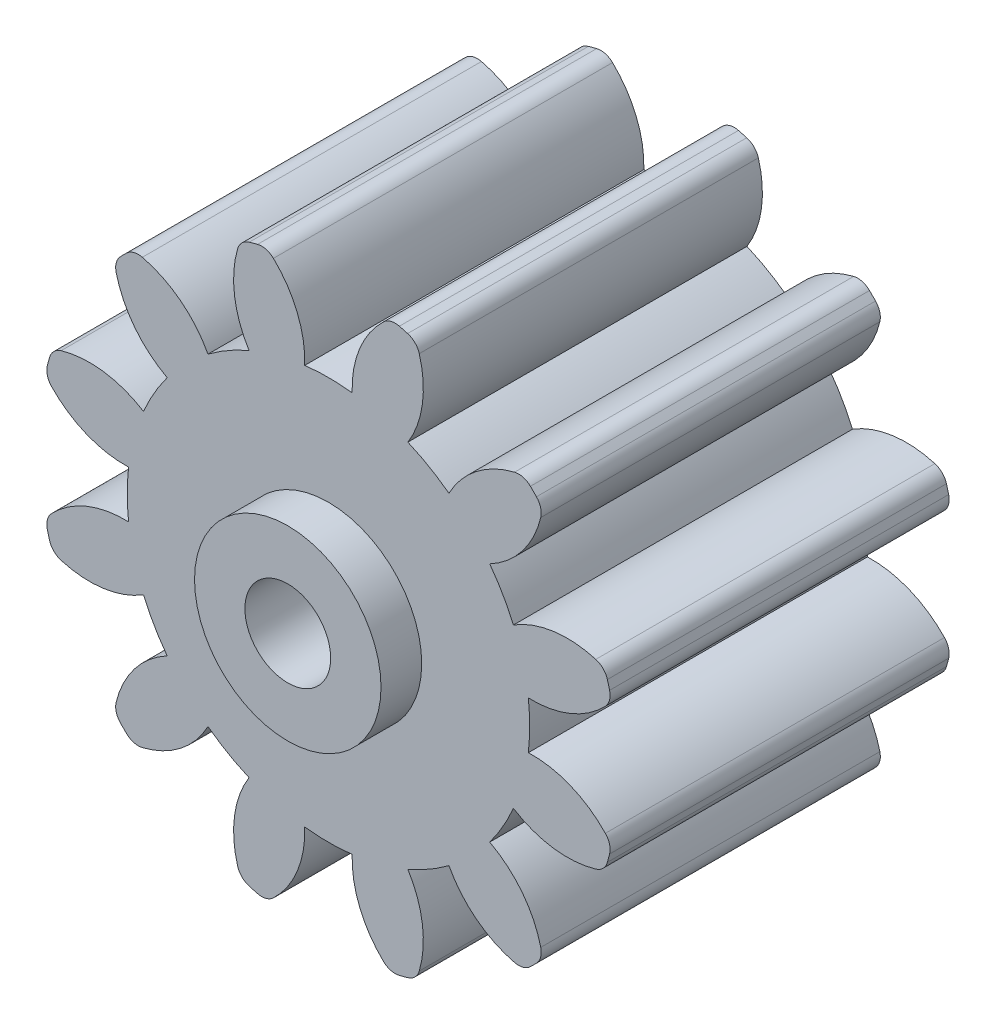
from build123d import *

# Parameters (mm, degrees)
SKETCH_1_R               = 1.265
EXTRUDE_1_DEPTH          = 10
SKETCH_2_R               = 2.75
SKETCH_2_R_2             = 1.265
EXTRUDE_2_DEPTH          = 1.2
SKETCH_3_R               = 10.210079725
SKETCH_3_R_2             = 7.3
CUT_EXTRUDE_2_DEPTH      = 16.316956182
FILLET_1_R               = 0.5
PATTERN_CIRCULAR_2_DEPTH = 10
CUT_EXTRUDE_START        = -10
SKETCH_5_R               = 9.117609572
SKETCH_5_R_2             = 4.6865
CUT_EXTRUDE_3_DEPTH      = 10
EXTRUDE_START            = -10
SKETCH_4_R               = 1.265
EXTRUDE_3_DEPTH          = 10
SKETCH_6_R               = 15.550265039
SKETCH_6_R_2             = 8.55
CUT_EXTRUDE_4_DEPTH      = 10
FILLET_2_R               = 0.5
PATTERN_CIRCULAR_4_DEPTH = 10


# Read off the part's stored shape, not the designer's step: Круговой массив2, Круговой массив4
with BuildPart() as part:
    # Эскиз1 → Бобышка-Вытянуть1 (new body)
    with BuildSketch(Plane.XY):
        with BuildLine():
            ThreePointArc((-3.148803906, 3.471068454), (-4.227852242, 4.566214035), (-5.743712894, 4.822837566))
            ThreePointArc((-5.743712894, 4.822837566), (-5.841480421, 4.703945843), (-5.936787387, 4.583072716))
            ThreePointArc((-5.936787387, 4.583072716), (-5.362797198, 3.156810321), (-4.062728379, 2.336133637))
            ThreePointArc((-4.062728379, 2.336133637), (-4.379801209, 1.667520202), (-4.587678719, 0.95733287))
            ThreePointArc((-4.587678719, 0.95733287), (-6.104357582, 1.209075557), (-7.481554138, 0.525687819))
            ThreePointArc((-7.481554138, 0.525687819), (-7.490766927, 0.372036085), (-7.496824441, 0.218227641))
            ThreePointArc((-7.496824441, 0.218227641), (-6.194120622, -0.598259906), (-4.659961201, -0.498040012))
            ThreePointArc((-4.659961201, -0.498040012), (-4.523477392, -1.225330377), (-4.274216191, -1.922071332))
            ThreePointArc((-4.274216191, -1.922071332), (-5.649205805, -2.609888688), (-6.361695989, -3.972256807))
            ThreePointArc((-6.361695989, -3.972256807), (-6.278835069, -4.101978813), (-6.193329365, -4.229972975))
            ThreePointArc((-6.193329365, -4.229972975), (-4.659500498, -4.124815183), (-3.477247231, -3.141979304))
            ThreePointArc((-3.477247231, -3.141979304), (-2.939338959, -3.650146399), (-2.328148353, -4.067309614))
            ThreePointArc((-2.328148353, -4.067309614), (-3.03624942, -5.431964161), (-2.811886199, -6.952934345))
            ThreePointArc((-2.811886199, -6.952934345), (-2.668601624, -7.009177225), (-2.524192976, -7.062467686))
            ThreePointArc((-2.524192976, -7.062467686), (-1.345109555, -6.075831258), (-0.966343005, -4.585789294))
            ThreePointArc((-0.966343005, -4.585789294), (-0.232472948, -4.68073056), (0.507193024, -4.658973866))
            ThreePointArc((0.507193024, -4.658973866), (0.736451045, -6.179213951), (1.811968547, -7.277827285))
            ThreePointArc((1.811968547, -7.277827285), (1.960946938, -7.239108171), (2.109099336, -7.197339786))
            ThreePointArc((2.109099336, -7.197339786), (2.483067519, -5.706086302), (1.913671403, -4.277983638))
            ThreePointArc((1.913671403, -4.277983638), (2.563189827, -3.92343474), (3.148803906, -3.471068454))
            ThreePointArc((3.148803906, -3.471068454), (4.227852242, -4.566214035), (5.743712894, -4.822837566))
            ThreePointArc((5.743712894, -4.822837566), (5.841480421, -4.703945843), (5.936787387, -4.583072716))
            ThreePointArc((5.936787387, -4.583072716), (5.362797198, -3.156810321), (4.062728379, -2.336133637))
            ThreePointArc((4.062728379, -2.336133637), (4.379801209, -1.667520202), (4.587678719, -0.95733287))
            ThreePointArc((4.587678719, -0.95733287), (6.104357582, -1.209075557), (7.481554138, -0.525687819))
            ThreePointArc((7.481554138, -0.525687819), (7.490766927, -0.372036085), (7.496824441, -0.218227641))
            ThreePointArc((7.496824441, -0.218227641), (6.194120622, 0.598259906), (4.659961201, 0.498040012))
            ThreePointArc((4.659961201, 0.498040012), (4.523477392, 1.225330377), (4.274216191, 1.922071332))
            ThreePointArc((4.274216191, 1.922071332), (5.649205805, 2.609888688), (6.361695989, 3.972256807))
            ThreePointArc((6.361695989, 3.972256807), (6.278835069, 4.101978813), (6.193329365, 4.229972975))
            ThreePointArc((6.193329365, 4.229972975), (4.659500498, 4.124815183), (3.477247231, 3.141979304))
            ThreePointArc((3.477247231, 3.141979304), (2.939338959, 3.650146399), (2.328148353, 4.067309614))
            ThreePointArc((2.328148353, 4.067309614), (3.03624942, 5.431964161), (2.811886199, 6.952934345))
            ThreePointArc((2.811886199, 6.952934345), (2.668601624, 7.009177225), (2.524192976, 7.062467686))
            ThreePointArc((2.524192976, 7.062467686), (1.345109555, 6.075831258), (0.966343005, 4.585789294))
            ThreePointArc((0.966343005, 4.585789294), (0.232472948, 4.68073056), (-0.507193024, 4.658973866))
            ThreePointArc((-0.507193024, 4.658973866), (-0.736451045, 6.179213951), (-1.811968547, 7.277827285))
            ThreePointArc((-1.811968547, 7.277827285), (-1.960946938, 7.239108171), (-2.109099336, 7.197339786))
            ThreePointArc((-2.109099336, 7.197339786), (-2.483067519, 5.706086302), (-1.913671403, 4.277983638))
            ThreePointArc((-1.913671403, 4.277983638), (-2.563189827, 3.92343474), (-3.148803906, 3.471068454))
        make_face()
        Circle(SKETCH_1_R, mode=Mode.SUBTRACT)
    extrude(amount=EXTRUDE_1_DEPTH)

    # Эскиз2 → Бобышка-Вытянуть2 (add)
    with BuildSketch(Plane.XY.offset(10)):
        Circle(SKETCH_2_R)
        Circle(SKETCH_2_R_2, mode=Mode.SUBTRACT)
    extrude(amount=EXTRUDE_2_DEPTH)

    # Эскиз3 → Вырез-Вытянуть2 (cut, through all)
    with BuildSketch(Plane(origin=(0, 0, 0), x_dir=(-1, 0, 0), z_dir=(0, 0, -1))):
        Circle(SKETCH_3_R)
        Circle(SKETCH_3_R_2, mode=Mode.SUBTRACT)
    extrude(amount=-CUT_EXTRUDE_2_DEPTH, mode=Mode.SUBTRACT)

    # Скругление1
    fillet_1_edges = [part.edges().sort_by_distance(p)[0] for p in [
        (-2.246892365, 6.945608303, 5),
        (-1.565958675, 7.13006125, 5),
    ]]
    fillet(fillet_1_edges, radius=FILLET_1_R)

    # Круговой массив2 outline → Круговой массив2 (cut)
    with BuildSketch(Plane.XY):
        with BuildLine():
            ThreePointArc((-5.838293306, 4.042408612), (-5.850561559, 4.278183981), (-5.753278974, 4.493304024))
            ThreePointArc((-5.753278974, 4.493304024), (-5.827604273, 4.396479095), (-5.900300237, 4.298424958))
            ThreePointArc((-5.900300237, 4.298424958), (-5.872671085, 4.169599529), (-5.838293306, 4.042408612))
        make_face()
        with BuildLine():
            ThreePointArc((-5.457832031, 4.847893307), (-5.538127486, 4.755958783), (-5.61687454, 4.662694543))
            ThreePointArc((-5.61687454, 4.662694543), (-5.427449488, 4.803615386), (-5.19448163, 4.841910441))
            ThreePointArc((-5.19448163, 4.841910441), (-5.326077976, 4.84837285), (-5.457832031, 4.847893307))
        make_face()
        with BuildLine():
            ThreePointArc((-7.099346669, -0.161285439), (-7.247857179, 0.022249743), (-7.295598302, 0.253466783))
            ThreePointArc((-7.295598302, 0.253466783), (-7.298816468, 0.131446456), (-7.299993962, 0.009389377))
            ThreePointArc((-7.299993962, 0.009389377), (-7.201919821, -0.078592576), (-7.099346669, -0.161285439))
        make_face()
        with BuildLine():
            ThreePointArc((-7.264999056, 0.713994895), (-7.275921686, 0.592421818), (-7.284810046, 0.470683106))
            ThreePointArc((-7.284810046, 0.470683106), (-7.214393154, 0.696031715), (-7.048427465, 0.863948137))
            ThreePointArc((-7.048427465, 0.863948137), (-7.158689654, 0.791825944), (-7.264999056, 0.713994895))
        make_face()
        with BuildLine():
            ThreePointArc((-5.648690902, -4.303373934), (-5.876717701, -4.24218314), (-6.051247048, -4.083186154))
            ThreePointArc((-6.051247048, -4.083186154), (-5.982128849, -4.183794263), (-5.911338111, -4.283232627))
            ThreePointArc((-5.911338111, -4.283232627), (-5.78027997, -4.296764989), (-5.648690902, -4.303373934))
        make_face()
        with BuildLine():
            ThreePointArc((-6.29718337, -3.692625299), (-6.234561102, -3.797400146), (-6.170195716, -3.90111328))
            ThreePointArc((-6.170195716, -3.90111328), (-6.245683843, -3.677412414), (-6.210113576, -3.444012991))
            ThreePointArc((-6.210113576, -3.444012991), (-6.2569252, -3.567171559), (-6.29718337, -3.692625299))
        make_face()
        with BuildLine():
            ThreePointArc((-2.040427202, -6.801719852), (-2.260871804, -6.88624625), (-2.495525095, -6.860200762))
            ThreePointArc((-2.495525095, -6.860200762), (-2.380471335, -6.900967774), (-2.264752021, -6.939805349))
            ThreePointArc((-2.264752021, -6.939805349), (-2.150769635, -6.873719217), (-2.040427202, -6.801719852))
        make_face()
        with BuildLine():
            ThreePointArc((-2.92405767, -6.688788137), (-2.811810081, -6.736744322), (-2.69877634, -6.782816986))
            ThreePointArc((-2.69877634, -6.782816986), (-2.891335587, -6.646209992), (-2.999747375, -6.436478214))
            ThreePointArc((-2.999747375, -6.436478214), (-2.965227985, -6.563630771), (-2.92405767, -6.688788137))
        make_face()
        with BuildLine():
            ThreePointArc((2.347210337, -6.702039969), (2.218550278, -6.899997348), (2.013402624, -7.016851849))
            ThreePointArc((2.013402624, -7.016851849), (2.130445319, -6.982206151), (2.246892365, -6.945608303))
            ThreePointArc((2.246892365, -6.945608303), (2.300261598, -6.825146334), (2.347210337, -6.702039969))
        make_face()
        with BuildLine():
            ThreePointArc((1.565958675, -7.13006125), (1.684956821, -7.102881142), (1.80348387, -7.073715143))
            ThreePointArc((1.80348387, -7.073715143), (1.56740459, -7.076381249), (1.356420365, -6.970427527))
            ThreePointArc((1.356420365, -6.970427527), (1.459085537, -7.053006118), (1.565958675, -7.13006125))
        make_face()
        with BuildLine():
            ThreePointArc((5.838293306, -4.042408612), (5.850561559, -4.278183981), (5.753278974, -4.493304024))
            ThreePointArc((5.753278974, -4.493304024), (5.827604273, -4.396479095), (5.900300237, -4.298424958))
            ThreePointArc((5.900300237, -4.298424958), (5.872671085, -4.169599529), (5.838293306, -4.042408612))
        make_face()
        with BuildLine():
            ThreePointArc((5.457832031, -4.847893307), (5.538127486, -4.755958783), (5.61687454, -4.662694543))
            ThreePointArc((5.61687454, -4.662694543), (5.427449488, -4.803615386), (5.19448163, -4.841910441))
            ThreePointArc((5.19448163, -4.841910441), (5.326077976, -4.84837285), (5.457832031, -4.847893307))
        make_face()
        with BuildLine():
            ThreePointArc((7.099346669, 0.161285439), (7.247857179, -0.022249743), (7.295598302, -0.253466783))
            ThreePointArc((7.295598302, -0.253466783), (7.298816468, -0.131446456), (7.299993962, -0.009389377))
            ThreePointArc((7.299993962, -0.009389377), (7.201919821, 0.078592576), (7.099346669, 0.161285439))
        make_face()
        with BuildLine():
            ThreePointArc((7.264999056, -0.713994895), (7.275921686, -0.592421818), (7.284810046, -0.470683106))
            ThreePointArc((7.284810046, -0.470683106), (7.214393154, -0.696031715), (7.048427465, -0.863948137))
            ThreePointArc((7.048427465, -0.863948137), (7.158689654, -0.791825944), (7.264999056, -0.713994895))
        make_face()
        with BuildLine():
            ThreePointArc((5.648690902, 4.303373934), (5.876717701, 4.24218314), (6.051247048, 4.083186154))
            ThreePointArc((6.051247048, 4.083186154), (5.982128849, 4.183794263), (5.911338111, 4.283232627))
            ThreePointArc((5.911338111, 4.283232627), (5.78027997, 4.296764989), (5.648690902, 4.303373934))
        make_face()
        with BuildLine():
            ThreePointArc((6.29718337, 3.692625299), (6.234561102, 3.797400146), (6.170195716, 3.90111328))
            ThreePointArc((6.170195716, 3.90111328), (6.245683843, 3.677412414), (6.210113576, 3.444012991))
            ThreePointArc((6.210113576, 3.444012991), (6.2569252, 3.567171559), (6.29718337, 3.692625299))
        make_face()
        with BuildLine():
            ThreePointArc((2.040427202, 6.801719852), (2.260871804, 6.88624625), (2.495525095, 6.860200762))
            ThreePointArc((2.495525095, 6.860200762), (2.380471335, 6.900967774), (2.264752021, 6.939805349))
            ThreePointArc((2.264752021, 6.939805349), (2.150769635, 6.873719217), (2.040427202, 6.801719852))
        make_face()
        with BuildLine():
            ThreePointArc((2.92405767, 6.688788137), (2.811810081, 6.736744322), (2.69877634, 6.782816986))
            ThreePointArc((2.69877634, 6.782816986), (2.891335587, 6.646209992), (2.999747375, 6.436478214))
            ThreePointArc((2.999747375, 6.436478214), (2.965227985, 6.563630771), (2.92405767, 6.688788137))
        make_face()
    extrude(amount=PATTERN_CIRCULAR_2_DEPTH, mode=Mode.SUBTRACT)

    # Эскиз5 → Вырез-Вытянуть3 (cut)
    with BuildSketch(Plane.XY.offset(10).offset(CUT_EXTRUDE_START)):
        Circle(SKETCH_5_R)
        Circle(SKETCH_5_R_2, mode=Mode.SUBTRACT)
    extrude(amount=CUT_EXTRUDE_3_DEPTH, mode=Mode.SUBTRACT)

    # Эскиз4 → Бобышка-Вытянуть3 (add)
    with BuildSketch(Plane.XY.offset(10).offset(EXTRUDE_START)):
        with BuildLine():
            ThreePointArc((4.755723654, 3.55318516), (5.872933327, 4.582980438), (6.342289434, 6.028089642))
            ThreePointArc((6.342289434, 6.028089642), (6.187184335, 6.187184335), (6.028089642, 6.342289434))
            ThreePointArc((6.028089642, 6.342289434), (4.582980438, 5.872933327), (3.55318516, 4.755723654))
            ThreePointArc((3.55318516, 4.755723654), (2.96825, 5.14115981), (2.341984918, 5.45501044))
            ThreePointArc((2.341984918, 5.45501044), (2.794619237, 6.905444148), (2.478538947, 8.391623483))
            ThreePointArc((2.478538947, 8.391623483), (2.264666645, 8.45185098), (2.049334049, 8.506628589))
            ThreePointArc((2.049334049, 8.506628589), (1.03251082, 7.377599675), (0.699286786, 5.895170077))
            ThreePointArc((0.699286786, 5.895170077), (0, 5.9365), (-0.699286786, 5.895170077))
            ThreePointArc((-0.699286786, 5.895170077), (-1.03251082, 7.377599675), (-2.049334049, 8.506628589))
            ThreePointArc((-2.049334049, 8.506628589), (-2.264666645, 8.45185098), (-2.478538947, 8.391623483))
            ThreePointArc((-2.478538947, 8.391623483), (-2.794619237, 6.905444148), (-2.341984918, 5.45501044))
            ThreePointArc((-2.341984918, 5.45501044), (-2.96825, 5.14115981), (-3.55318516, 4.755723654))
            ThreePointArc((-3.55318516, 4.755723654), (-4.582980438, 5.872933327), (-6.028089642, 6.342289434))
            ThreePointArc((-6.028089642, 6.342289434), (-6.187184335, 6.187184335), (-6.342289434, 6.028089642))
            ThreePointArc((-6.342289434, 6.028089642), (-5.872933327, 4.582980438), (-4.755723654, 3.55318516))
            ThreePointArc((-4.755723654, 3.55318516), (-5.14115981, 2.96825), (-5.45501044, 2.341984918))
            ThreePointArc((-5.45501044, 2.341984918), (-6.905444148, 2.794619237), (-8.391623483, 2.478538947))
            ThreePointArc((-8.391623483, 2.478538947), (-8.45185098, 2.264666645), (-8.506628589, 2.049334049))
            ThreePointArc((-8.506628589, 2.049334049), (-7.377599675, 1.03251082), (-5.895170077, 0.699286786))
            ThreePointArc((-5.895170077, 0.699286786), (-5.9365, 0), (-5.895170077, -0.699286786))
            ThreePointArc((-5.895170077, -0.699286786), (-7.377599675, -1.03251082), (-8.506628589, -2.049334049))
            ThreePointArc((-8.506628589, -2.049334049), (-8.45185098, -2.264666645), (-8.391623483, -2.478538947))
            ThreePointArc((-8.391623483, -2.478538947), (-6.905444148, -2.794619237), (-5.45501044, -2.341984918))
            ThreePointArc((-5.45501044, -2.341984918), (-5.14115981, -2.96825), (-4.755723654, -3.55318516))
            ThreePointArc((-4.755723654, -3.55318516), (-5.872933327, -4.582980438), (-6.342289434, -6.028089642))
            ThreePointArc((-6.342289434, -6.028089642), (-6.187184335, -6.187184335), (-6.028089642, -6.342289434))
            ThreePointArc((-6.028089642, -6.342289434), (-4.582980438, -5.872933327), (-3.55318516, -4.755723654))
            ThreePointArc((-3.55318516, -4.755723654), (-2.96825, -5.14115981), (-2.341984918, -5.45501044))
            ThreePointArc((-2.341984918, -5.45501044), (-2.794619237, -6.905444148), (-2.478538947, -8.391623483))
            ThreePointArc((-2.478538947, -8.391623483), (-2.264666645, -8.45185098), (-2.049334049, -8.506628589))
            ThreePointArc((-2.049334049, -8.506628589), (-1.03251082, -7.377599675), (-0.699286786, -5.895170077))
            ThreePointArc((-0.699286786, -5.895170077), (0, -5.9365), (0.699286786, -5.895170077))
            ThreePointArc((0.699286786, -5.895170077), (1.03251082, -7.377599675), (2.049334049, -8.506628589))
            ThreePointArc((2.049334049, -8.506628589), (2.264666645, -8.45185098), (2.478538947, -8.391623483))
            ThreePointArc((2.478538947, -8.391623483), (2.794619237, -6.905444148), (2.341984918, -5.45501044))
            ThreePointArc((2.341984918, -5.45501044), (2.96825, -5.14115981), (3.55318516, -4.755723654))
            ThreePointArc((3.55318516, -4.755723654), (4.582980438, -5.872933327), (6.028089642, -6.342289434))
            ThreePointArc((6.028089642, -6.342289434), (6.187184335, -6.187184335), (6.342289434, -6.028089642))
            ThreePointArc((6.342289434, -6.028089642), (5.872933327, -4.582980438), (4.755723654, -3.55318516))
            ThreePointArc((4.755723654, -3.55318516), (5.14115981, -2.96825), (5.45501044, -2.341984918))
            ThreePointArc((5.45501044, -2.341984918), (6.905444148, -2.794619237), (8.391623483, -2.478538947))
            ThreePointArc((8.391623483, -2.478538947), (8.45185098, -2.264666645), (8.506628589, -2.049334049))
            ThreePointArc((8.506628589, -2.049334049), (7.377599675, -1.03251082), (5.895170077, -0.699286786))
            ThreePointArc((5.895170077, -0.699286786), (5.9365, 0), (5.895170077, 0.699286786))
            ThreePointArc((5.895170077, 0.699286786), (7.377599675, 1.03251082), (8.506628589, 2.049334049))
            ThreePointArc((8.506628589, 2.049334049), (8.45185098, 2.264666645), (8.391623483, 2.478538947))
            ThreePointArc((8.391623483, 2.478538947), (6.905444148, 2.794619237), (5.45501044, 2.341984918))
            ThreePointArc((5.45501044, 2.341984918), (5.14115981, 2.96825), (4.755723654, 3.55318516))
        make_face()
        Circle(SKETCH_4_R, mode=Mode.SUBTRACT)
    extrude(amount=EXTRUDE_3_DEPTH)

    # Эскиз6 → Вырез-Вытянуть4 (cut)
    with BuildSketch(Plane.XY.offset(10)):
        Circle(SKETCH_6_R)
        Circle(SKETCH_6_R_2, mode=Mode.SUBTRACT)
    extrude(amount=-CUT_EXTRUDE_4_DEPTH, mode=Mode.SUBTRACT)

    # Скругление2
    fillet_2_edges = [part.edges().sort_by_distance(p)[0] for p in [
        (-1.834015536, 8.350981201, 5),
        (-2.587186555, 8.149169634, 5),
    ]]
    fillet(fillet_2_edges, radius=FILLET_2_R)

    # Круговой массив4 outline → Круговой массив4 (cut)
    with BuildSketch(Plane.XY):
        with BuildLine():
            ThreePointArc((5.763794646, 6.315154098), (5.625595497, 6.291434191), (5.48865567, 6.261282532))
            ThreePointArc((5.48865567, 6.261282532), (5.738638085, 6.258135911), (5.955848779, 6.134359406))
            ThreePointArc((5.955848779, 6.134359406), (5.860518934, 6.225497395), (5.763794646, 6.315154098))
        make_face()
        with BuildLine():
            ThreePointArc((6.315154098, 5.763794646), (6.225497395, 5.860518934), (6.134359406, 5.955848779))
            ThreePointArc((6.134359406, 5.955848779), (6.258135911, 5.738638085), (6.261282532, 5.48865567))
            ThreePointArc((6.261282532, 5.48865567), (6.291434191, 5.625595497), (6.315154098, 5.763794646))
        make_face()
        with BuildLine():
            ThreePointArc((1.834015536, 8.350981201), (1.726191515, 8.261339585), (1.622673976, 8.166757568))
            ThreePointArc((1.622673976, 8.166757568), (1.840738409, 8.289023721), (2.090736641, 8.290435471))
            ThreePointArc((2.090736641, 8.290435471), (1.962609579, 8.321698363), (1.834015536, 8.350981201))
        make_face()
        with BuildLine():
            ThreePointArc((2.587186555, 8.149169634), (2.461179428, 8.188106974), (2.334586692, 8.225096047))
            ThreePointArc((2.334586692, 8.225096047), (2.550385637, 8.09887432), (2.678101898, 7.883956508))
            ThreePointArc((2.678101898, 7.883956508), (2.635744088, 8.017625707), (2.587186555, 8.149169634))
        make_face()
        with BuildLine():
            ThreePointArc((-6.315154098, 5.763794646), (-6.291434191, 5.625595497), (-6.261282532, 5.48865567))
            ThreePointArc((-6.261282532, 5.48865567), (-6.258135911, 5.738638085), (-6.134359406, 5.955848779))
            ThreePointArc((-6.134359406, 5.955848779), (-6.225497395, 5.860518934), (-6.315154098, 5.763794646))
        make_face()
        with BuildLine():
            ThreePointArc((-5.763794646, 6.315154098), (-5.860518934, 6.225497395), (-5.955848779, 6.134359406))
            ThreePointArc((-5.955848779, 6.134359406), (-5.738638085, 6.258135911), (-5.48865567, 6.261282532))
            ThreePointArc((-5.48865567, 6.261282532), (-5.625595497, 6.291434191), (-5.763794646, 6.315154098))
        make_face()
        with BuildLine():
            ThreePointArc((-8.350981201, 1.834015536), (-8.261339585, 1.726191515), (-8.166757568, 1.622673976))
            ThreePointArc((-8.166757568, 1.622673976), (-8.289023721, 1.840738409), (-8.290435471, 2.090736641))
            ThreePointArc((-8.290435471, 2.090736641), (-8.321698363, 1.962609579), (-8.350981201, 1.834015536))
        make_face()
        with BuildLine():
            ThreePointArc((-8.149169634, 2.587186555), (-8.188106974, 2.461179428), (-8.225096047, 2.334586692))
            ThreePointArc((-8.225096047, 2.334586692), (-8.09887432, 2.550385637), (-7.883956508, 2.678101898))
            ThreePointArc((-7.883956508, 2.678101898), (-8.017625707, 2.635744088), (-8.149169634, 2.587186555))
        make_face()
        with BuildLine():
            ThreePointArc((-8.149169634, -2.587186555), (-8.017625707, -2.635744088), (-7.883956508, -2.678101898))
            ThreePointArc((-7.883956508, -2.678101898), (-8.09887432, -2.550385637), (-8.225096047, -2.334586692))
            ThreePointArc((-8.225096047, -2.334586692), (-8.188106974, -2.461179428), (-8.149169634, -2.587186555))
        make_face()
        with BuildLine():
            ThreePointArc((-8.350981201, -1.834015536), (-8.321698363, -1.962609579), (-8.290435471, -2.090736641))
            ThreePointArc((-8.290435471, -2.090736641), (-8.289023721, -1.840738409), (-8.166757568, -1.622673976))
            ThreePointArc((-8.166757568, -1.622673976), (-8.261339585, -1.726191515), (-8.350981201, -1.834015536))
        make_face()
        with BuildLine():
            ThreePointArc((-5.763794646, -6.315154098), (-5.625595497, -6.291434191), (-5.48865567, -6.261282532))
            ThreePointArc((-5.48865567, -6.261282532), (-5.738638085, -6.258135911), (-5.955848779, -6.134359406))
            ThreePointArc((-5.955848779, -6.134359406), (-5.860518934, -6.225497395), (-5.763794646, -6.315154098))
        make_face()
        with BuildLine():
            ThreePointArc((-6.315154098, -5.763794646), (-6.225497395, -5.860518934), (-6.134359406, -5.955848779))
            ThreePointArc((-6.134359406, -5.955848779), (-6.258135911, -5.738638085), (-6.261282532, -5.48865567))
            ThreePointArc((-6.261282532, -5.48865567), (-6.291434191, -5.625595497), (-6.315154098, -5.763794646))
        make_face()
        with BuildLine():
            ThreePointArc((-1.834015536, -8.350981201), (-1.726191515, -8.261339585), (-1.622673976, -8.166757568))
            ThreePointArc((-1.622673976, -8.166757568), (-1.840738409, -8.289023721), (-2.090736641, -8.290435471))
            ThreePointArc((-2.090736641, -8.290435471), (-1.962609579, -8.321698363), (-1.834015536, -8.350981201))
        make_face()
        with BuildLine():
            ThreePointArc((-2.587186555, -8.149169634), (-2.461179428, -8.188106974), (-2.334586692, -8.225096047))
            ThreePointArc((-2.334586692, -8.225096047), (-2.550385637, -8.09887432), (-2.678101898, -7.883956508))
            ThreePointArc((-2.678101898, -7.883956508), (-2.635744088, -8.017625707), (-2.587186555, -8.149169634))
        make_face()
        with BuildLine():
            ThreePointArc((2.587186555, -8.149169634), (2.635744088, -8.017625707), (2.678101898, -7.883956508))
            ThreePointArc((2.678101898, -7.883956508), (2.550385637, -8.09887432), (2.334586692, -8.225096047))
            ThreePointArc((2.334586692, -8.225096047), (2.461179428, -8.188106974), (2.587186555, -8.149169634))
        make_face()
        with BuildLine():
            ThreePointArc((1.834015536, -8.350981201), (1.962609579, -8.321698363), (2.090736641, -8.290435471))
            ThreePointArc((2.090736641, -8.290435471), (1.840738409, -8.289023721), (1.622673976, -8.166757568))
            ThreePointArc((1.622673976, -8.166757568), (1.726191515, -8.261339585), (1.834015536, -8.350981201))
        make_face()
        with BuildLine():
            ThreePointArc((6.315154098, -5.763794646), (6.291434191, -5.625595497), (6.261282532, -5.48865567))
            ThreePointArc((6.261282532, -5.48865567), (6.258135911, -5.738638085), (6.134359406, -5.955848779))
            ThreePointArc((6.134359406, -5.955848779), (6.225497395, -5.860518934), (6.315154098, -5.763794646))
        make_face()
        with BuildLine():
            ThreePointArc((5.763794646, -6.315154098), (5.860518934, -6.225497395), (5.955848779, -6.134359406))
            ThreePointArc((5.955848779, -6.134359406), (5.738638085, -6.258135911), (5.48865567, -6.261282532))
            ThreePointArc((5.48865567, -6.261282532), (5.625595497, -6.291434191), (5.763794646, -6.315154098))
        make_face()
        with BuildLine():
            ThreePointArc((8.350981201, -1.834015536), (8.261339585, -1.726191515), (8.166757568, -1.622673976))
            ThreePointArc((8.166757568, -1.622673976), (8.289023721, -1.840738409), (8.290435471, -2.090736641))
            ThreePointArc((8.290435471, -2.090736641), (8.321698363, -1.962609579), (8.350981201, -1.834015536))
        make_face()
        with BuildLine():
            ThreePointArc((8.149169634, -2.587186555), (8.188106974, -2.461179428), (8.225096047, -2.334586692))
            ThreePointArc((8.225096047, -2.334586692), (8.09887432, -2.550385637), (7.883956508, -2.678101898))
            ThreePointArc((7.883956508, -2.678101898), (8.017625707, -2.635744088), (8.149169634, -2.587186555))
        make_face()
        with BuildLine():
            ThreePointArc((8.149169634, 2.587186555), (8.017625707, 2.635744088), (7.883956508, 2.678101898))
            ThreePointArc((7.883956508, 2.678101898), (8.09887432, 2.550385637), (8.225096047, 2.334586692))
            ThreePointArc((8.225096047, 2.334586692), (8.188106974, 2.461179428), (8.149169634, 2.587186555))
        make_face()
        with BuildLine():
            ThreePointArc((8.350981201, 1.834015536), (8.321698363, 1.962609579), (8.290435471, 2.090736641))
            ThreePointArc((8.290435471, 2.090736641), (8.289023721, 1.840738409), (8.166757568, 1.622673976))
            ThreePointArc((8.166757568, 1.622673976), (8.261339585, 1.726191515), (8.350981201, 1.834015536))
        make_face()
    extrude(amount=PATTERN_CIRCULAR_4_DEPTH, mode=Mode.SUBTRACT)


solid = part.part
